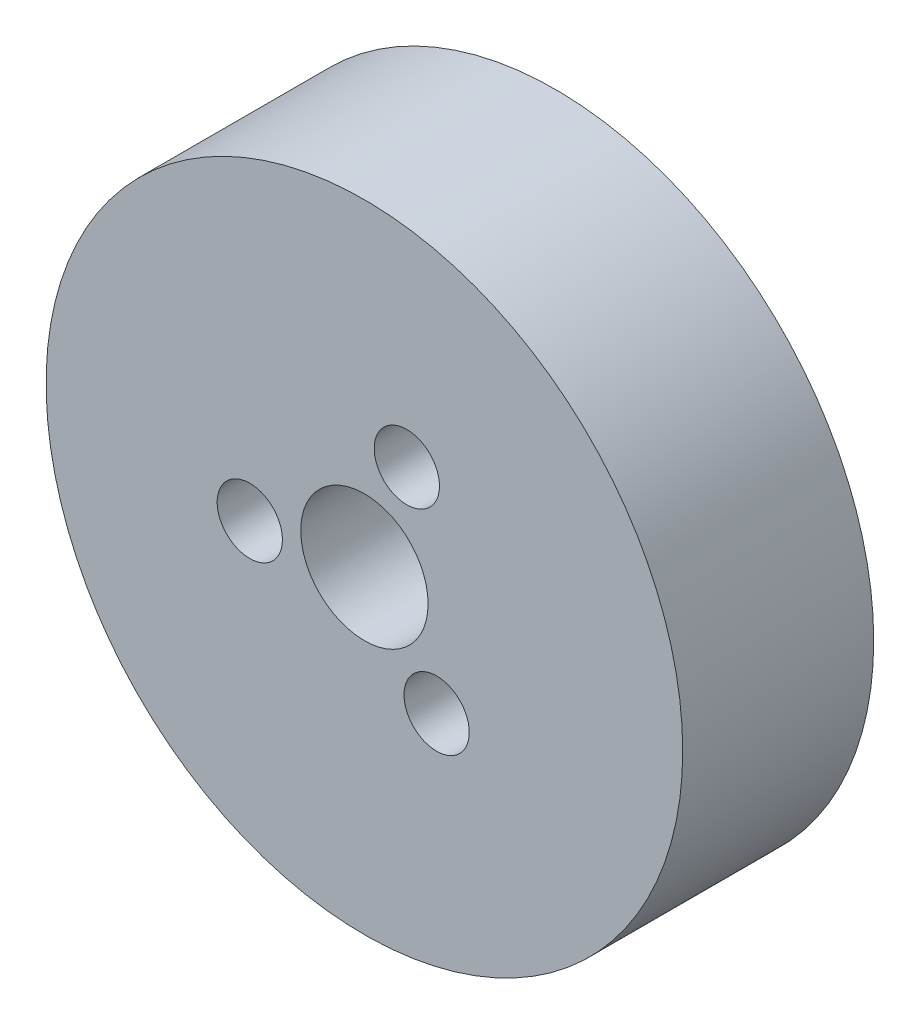
from build123d import *

# Parameters (mm, degrees)
SKETCH1_R                    = 10
SKETCH1_R_2                  = 2
BOSS_EXTRUDE1_DEPTH          = 6
F_2_05_2_05_DIAMETER_HOLE1_D = 2.05


with BuildPart() as part:
    # Sketch1 → Boss-Extrude1 (new body)
    with BuildSketch(Plane.XY):
        Circle(SKETCH1_R)
        Circle(SKETCH1_R_2, mode=Mode.SUBTRACT)
    extrude(amount=BOSS_EXTRUDE1_DEPTH)

    # Ø2.05 (2.05) Diameter Hole1 (through all)
    with Locations(Plane(origin=(-166.219089549, 17.54789674, 8.795501481), x_dir=(0.06288111672161824, -0.9980210244077238, 0), z_dir=(0, 0, 1))):
        with Locations((24.667042937, 166.329840483), (30.950682453, 166.871449852), (28.277910167, 161.158853719)):
            Hole(F_2_05_2_05_DIAMETER_HOLE1_D / 2)


solid = part.part
